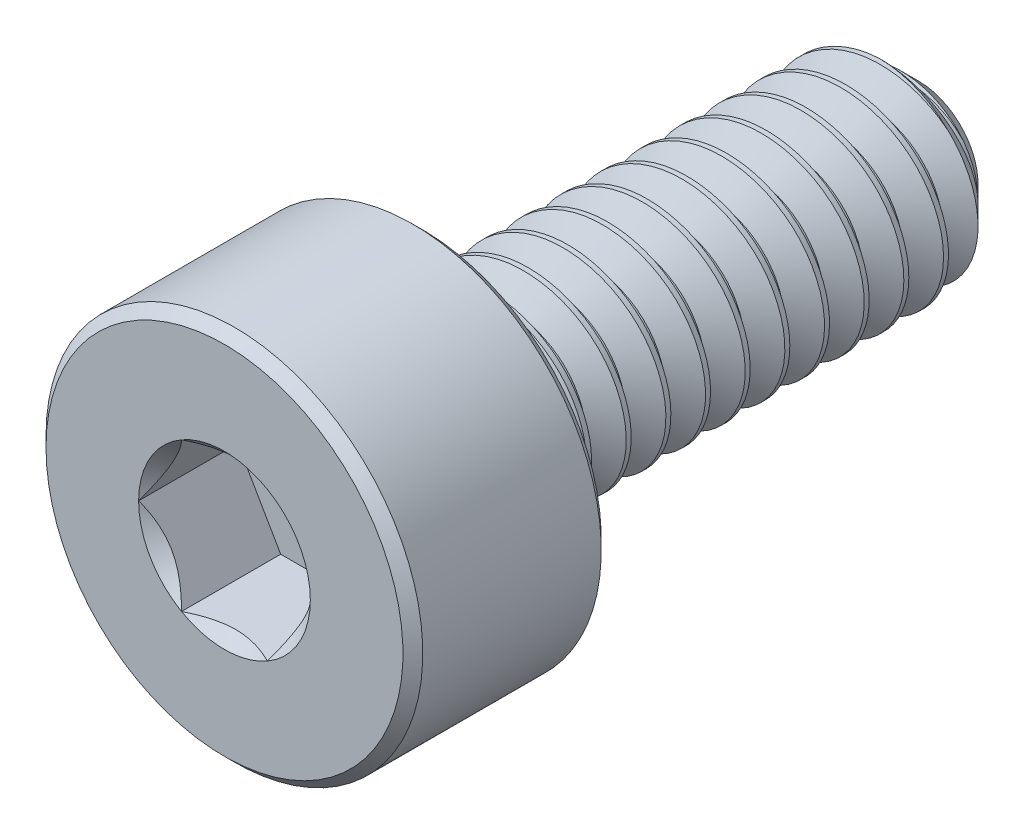
from build123d import *

# Parameters (mm, degrees)
CUT_EXTRUDE1_DEPTH = 1
CUT_SWEEP1_PITCH   = 0.4


# Read off the part's stored shape, not the designer's step: Split1, Boss-Extrude1
with BuildPart() as part:
    # Sketch2 → Revolve1 (revolve)
    with BuildSketch(Plane(origin=(0, 0, 0), x_dir=(0, 0, -1), z_dir=(1, 0, 0)), mode=Mode.PRIVATE) as revolve1_sk:
        Polygon((-3.5, 0), (-3.5, 1.8), (-3.4, 1.9), (-1.6, 1.9), (-1.5, 1.8), (-1.5, 1), (3.1, 1), (3.5, 0.6), (3.5, 0), align=None)
    revolve(revolve1_sk.sketch.rotate(Axis((0, 0, -3.5), (0, 0, 1)), 90), axis=Axis((0, 0, -3.5), (0, 0, 1)))

    # Sketch3 → Cut-Extrude1 (cut)
    with BuildSketch(Plane.XY.offset(3.5)):
        Polygon((0.433012702, 0.75), (-0.433012702, 0.75), (-0.866025404, 0), (-0.433012702, -0.75), (0.433012702, -0.75), (0.866025404, 0), align=None)
    extrude(amount=-CUT_EXTRUDE1_DEPTH, mode=Mode.SUBTRACT)

    # Cut-Extrude2 cone 1 section (through the dimple's axis) → Cut-Extrude2 (revolve, cut)
    with BuildSketch(Plane(origin=(0, 0, 3.5), x_dir=(0, -1, 0), z_dir=(1, 0, 0))):
        Polygon((0, 0), (0.866025404, 0), (0, 0.866025404), align=None)
    revolve(axis=Axis((0, 0, 3.5), (0, 0, -1)), mode=Mode.SUBTRACT)


with BuildPart() as body_2:
    # Split1: the piece on the far side of the plane
    add(part.part)
    split(bisect_by=Plane.XY.offset(1.5), keep=Keep.BOTTOM)

    # Cut-Sweep1: the profile of Sketch7 screwed along a right-hand helix of 13.5 turns, 6 arcs to a turn; built about Z, then put on its axis
    cut_sweep1_z = Axis((0, 0, 0), (0, 0, 1))
    cut_sweep1_corners = [(1.021650635, 0, 0.0125), (1.021650635, 0, -0.3625), (0.740192379, 0, -0.2), (0.740192379, 0, -0.15)]
    with BuildLine(mode=Mode.PRIVATE) as cut_sweep1_profile:
        Line(cut_sweep1_corners[0], cut_sweep1_corners[1])
        Line(cut_sweep1_corners[1], cut_sweep1_corners[2])
        Line(cut_sweep1_corners[2], cut_sweep1_corners[3])
        Line(cut_sweep1_corners[3], cut_sweep1_corners[0])
    cut_sweep1_cap = Face(cut_sweep1_profile.wire())
    cut_sweep1_turn_angles = [0, 30, 60, 90, 120, 150, 180, 210, 240, 270, 300, 330, 360]
    cut_sweep1_turn_weights = [1, 0.8660254037844387, 1, 0.8660254037844387, 1, 0.8660254037844387, 1, 0.8660254037844387, 1, 0.8660254037844387, 1, 0.8660254037844387, 1]
    cut_sweep1_turn_rails = [Edge.make_bspline([Vector(p[0], p[1], 0).rotate(cut_sweep1_z, cut_sweep1_turn_angles[k]) / cut_sweep1_turn_weights[k] + Vector(0, 0, p[2] + CUT_SWEEP1_PITCH * cut_sweep1_turn_angles[k] / 360) for k in range(13)], [0, 0, 0, 1, 1, 2, 2, 3, 3, 4, 4, 5, 5, 6, 6, 6], 2, cut_sweep1_turn_weights) for p in cut_sweep1_corners]
    cut_sweep1_turn_sides = [Face.make_surface_from_curves(cut_sweep1_turn_rails[p[0]], cut_sweep1_turn_rails[p[1]]) for p in [(0, 1), (1, 2), (2, 3), (3, 0)]]
    cut_sweep1_turn = Solid(Shell([*cut_sweep1_turn_sides, cut_sweep1_cap, cut_sweep1_cap.rotate(cut_sweep1_z, 360).moved(Location((0, 0, CUT_SWEEP1_PITCH * 360 / 360)))]))
    cut_sweep1_last_angles = [4680, 4710, 4740, 4770, 4800, 4830, 4860]
    cut_sweep1_last_weights = [1, 0.8660254037844387, 1, 0.8660254037844387, 1, 0.8660254037844625, 1]
    cut_sweep1_last_rails = [Edge.make_bspline([Vector(p[0], p[1], 0).rotate(cut_sweep1_z, cut_sweep1_last_angles[k]) / cut_sweep1_last_weights[k] + Vector(0, 0, p[2] + CUT_SWEEP1_PITCH * cut_sweep1_last_angles[k] / 360) for k in range(7)], [0, 0, 0, 1, 1, 2, 2, 3, 3, 3], 2, cut_sweep1_last_weights) for p in cut_sweep1_corners]
    cut_sweep1_last_sides = [Face.make_surface_from_curves(cut_sweep1_last_rails[p[0]], cut_sweep1_last_rails[p[1]]) for p in [(0, 1), (1, 2), (2, 3), (3, 0)]]
    cut_sweep1_last = Solid(Shell([*cut_sweep1_last_sides, cut_sweep1_cap.rotate(cut_sweep1_z, 4680).moved(Location((0, 0, CUT_SWEEP1_PITCH * 4680 / 360))), cut_sweep1_cap.rotate(cut_sweep1_z, 4860).moved(Location((0, 0, CUT_SWEEP1_PITCH * 4860 / 360)))]))
    cut_sweep1_each = [*[cut_sweep1_turn.moved(Location((0, 0, CUT_SWEEP1_PITCH * i))) for i in range(13)], cut_sweep1_last]
    add(Plane(origin=(0, 0, -3.5), x_dir=(0, 1, 0), z_dir=(0, 0, 1)) * Compound([cut_sweep1_each[i] for i in range(0, 14, 2)]), mode=Mode.SUBTRACT)
    add(Plane(origin=(0, 0, -3.5), x_dir=(0, 1, 0), z_dir=(0, 0, 1)) * Compound([cut_sweep1_each[i] for i in range(1, 14, 2)]), mode=Mode.SUBTRACT)


with BuildPart() as part_1:
    add(part.part)

    # Split1
    split(bisect_by=Plane.XY.offset(1.5), keep=Keep.TOP)

    add(body_2.part)  # Boss-Extrude1 merges body 2
    # Boss-Extrude1 outline → Boss-Extrude1 (revolve)
    with BuildSketch(Plane.XZ):
        Polygon((0.740187951, 1.5), (0.740187951, 1.407995728), (1, 1.5), align=None)
    revolve(axis=Axis((0, 0, 0), (0, 0, 1)))


solid = part_1.part
